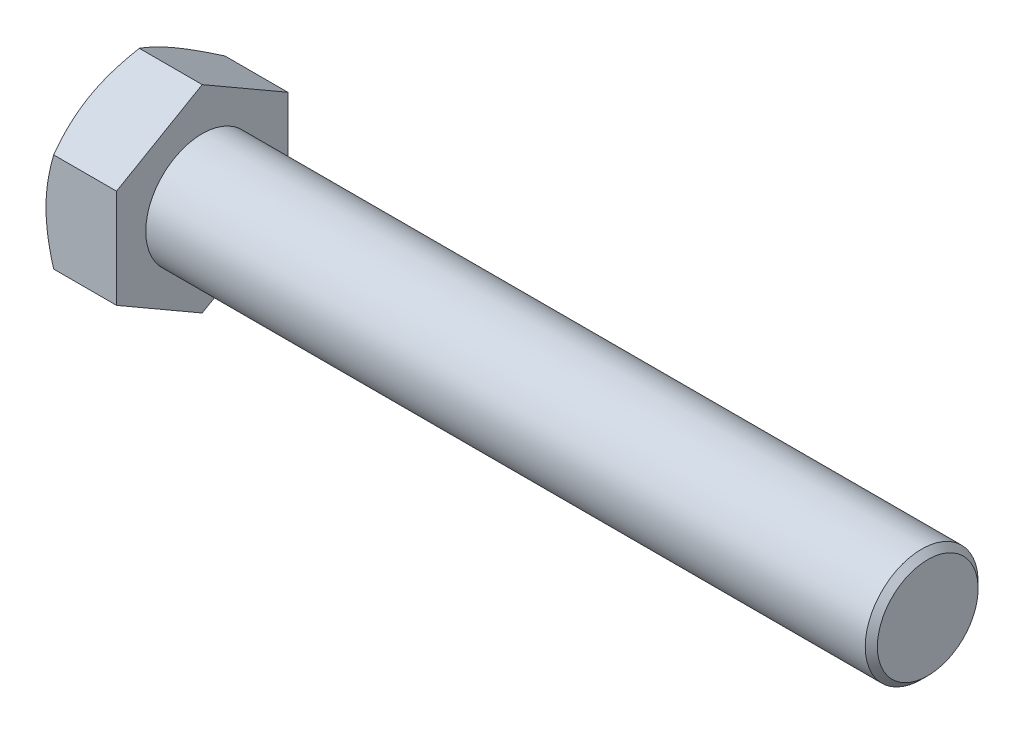
from build123d import *

# Parameters (mm, degrees)
BASEHEAD_DEPTH = 35


with BuildPart() as part:
    # BaseHeadSke → BaseHead (new body)
    with BuildSketch(Plane(origin=(0, 0, 0), x_dir=(0, 0, -1), z_dir=(1, 0, 0))):
        Polygon((0, 49.074772881), (-42.5, 24.537386441), (-42.5, -24.537386441), (0, -49.074772881), (42.5, -24.537386441), (42.5, 24.537386441), align=None)
    extrude(amount=BASEHEAD_DEPTH)

    # HeadChamferSke → HeadChamfer (revolve, cut)
    with BuildSketch(Plane.XY):
        Polygon((0, 49.074772881), (0, 42.5), (3.795946893, 49.074772881), align=None)
    revolve(axis=Axis((0, 0, 0), (1, 0, 0)), mode=Mode.SUBTRACT)

    # BodySke → BaseBody (revolve)
    with BuildSketch(Plane.XY):
        Polygon((0, 0), (0, 28), (391.9855, 28), (395, 24.9855), (395, 0), align=None)
    revolve(axis=Axis((0, 0, 0), (1, 0, 0)))


solid = part.part
